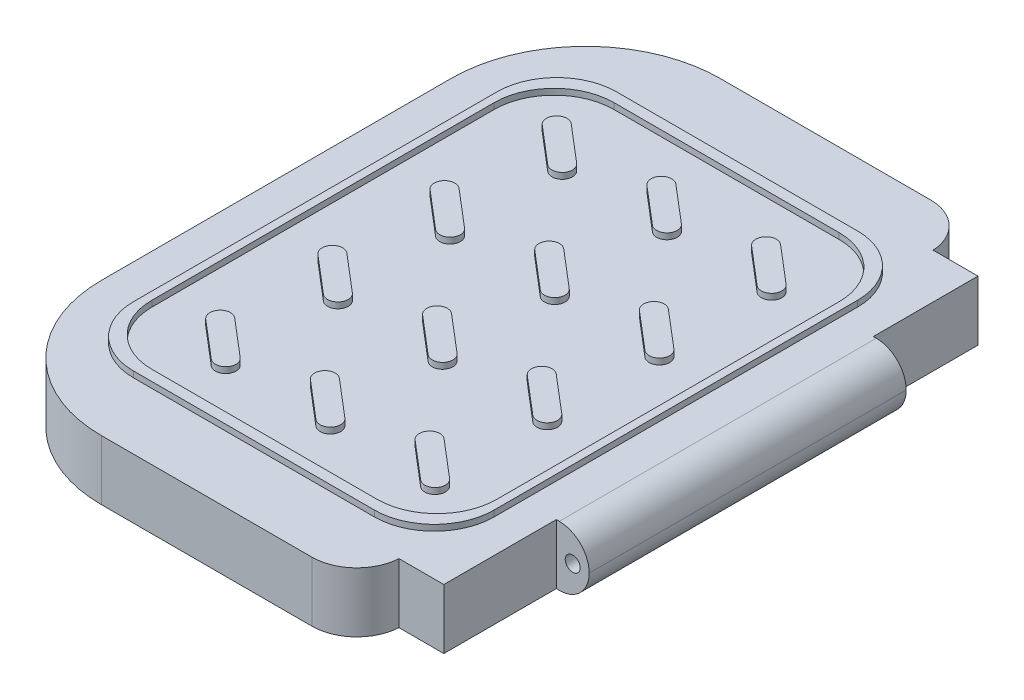
from build123d import *

# Parameters (mm, degrees)
BOSS_EXTRUDE1_DEPTH = 40
SKETCH2_R           = 5
CUT_EXTRUDE1_DEPTH  = 330
FILLET1_R           = 90
FILLET2_R           = 30
SHELL4_DEPTH        = 5.033370453
SHELL4_START        = -116.839892183
SHELL4_2_OUTLINE_W  = 270.611791966
SHELL4_2_OUTLINE_H  = 24.966629547
SHELL4_2_DEPTH      = 233.679784366
SHELL4_START_2      = -98.590943396
SHELL4_3_DEPTH      = 192
SHELL4_4_DEPTH      = 192
SHELL4_START_3      = 5.033370453
SHELL4_5_DEPTH      = 24.966629547
BOSS_EXTRUDE2_DEPTH = 4
BOSS_EXTRUDE3_DEPTH = 4
FILLET4_R           = 20


with BuildPart() as part:
    # Sketch1 → Boss-Extrude1 (new body)
    with BuildSketch(Plane(origin=(0, 0, 0), x_dir=(1, 0, 0), z_dir=(0, 1, 0))):
        Polygon((0, -103.409056604), (0, 108.590943396), (-22, 108.590943396), (-22, 178.590943396), (-51.997250674, 178.590943396), (-51.997250674, 206.839892183), (-312.611791966, 206.839892183), (-312.611791966, -206.839892183), (-51.997250674, -206.839892183), (-51.997250674, -178.590943396), (-22, -178.590943396), (-22, -173.409056604), (-22, -108.590943396), (-22, -103.409056604), align=None)
    extrude(amount=BOSS_EXTRUDE1_DEPTH)

    # Sketch2 → Cut-Extrude1 (cut, symmetric)
    with BuildSketch(Plane.XY.offset(103.409056604)):
        with Locations((-11, 20)):
            Circle(SKETCH2_R)
    extrude(amount=CUT_EXTRUDE1_DEPTH, both=True, mode=Mode.SUBTRACT)

    # Fillet1
    fillet1_edges = [part.edges().sort_by_distance(p)[0] for p in [
        (-312.611791966, 20, 206.839892183),
        (-312.611791966, 20, -206.839892183),
    ]]
    fillet(fillet1_edges, radius=FILLET1_R)

    # Fillet2
    # the kernel refuses this fillet: 30 mm, written as the material it takes off along each edge
    with BuildSketch(Plane(origin=(-51.997250674, -74.872133486, -206.839892183), x_dir=(-1, 0, 0), z_dir=(0, 1, 0))) as fillet2_piece_1:
        with BuildLine():
            CenterArc((29.948853395, 30), FILLET2_R, 183.3461633, 86.6538367)
            Line((0, 28.248948787), (-0.598977068, 28.213927763))
            ThreePointArc((-0.598977068, 28.213927763), (-0.6, 14.124474394), (-0.6, 0))
            Line((-0.6, 0), (0, -0.6))
            Line((0, -0.6), (29.948853395, -0.6))
            Line((29.948853395, -0.6), (29.948853395, 0))
        make_face()
    extrude(amount=189.744266973, mode=Mode.SUBTRACT)
    with BuildSketch(Plane(origin=(-51.997250674, -74.872133486, 206.839892183), x_dir=(-1, 0, 0), z_dir=(0, 1, 0))) as fillet2_piece_2:
        with BuildLine():
            CenterArc((29.948853395, -30), FILLET2_R, 90, 86.6538367)
            Line((0, -28.248948787), (-0.598977068, -28.213927763))
            ThreePointArc((-0.598977068, -28.213927763), (-0.6, -14.124474394), (-0.6, 0))
            Line((-0.6, 0), (0, 0.6))
            Line((0, 0.6), (29.948853395, 0.6))
            Line((29.948853395, 0.6), (29.948853395, 0))
        make_face()
    extrude(amount=189.744266973, mode=Mode.SUBTRACT)

    # Shell4: read off the stored shape, not the designer's step
    # Shell4 outline → Shell4 (cut)
    with BuildSketch(Plane(origin=(0, 0, 0), x_dir=(1, 0, 0), z_dir=(0, 1, 0))):
        with BuildLine():
            ThreePointArc((-302.611791966, -116.839892183), (-279.180334461, -173.408434678), (-222.611791966, -196.839892183))
            Line((-222.611791966, -196.839892183), (-81.946104068, -196.839892183))
            ThreePointArc((-81.946104068, -196.839892183), (-65.138680474, -187.680118755), (-63.726476084, -168.590943396))
            Line((-63.726476084, -168.590943396), (-32, -168.590943396))
            Line((-32, -168.590943396), (-32, -93.409056604))
            Line((-32, -93.409056604), (-10, -93.409056604))
            Line((-10, -93.409056604), (-10, 98.590943396))
            Line((-10, 98.590943396), (-32, 98.590943396))
            Line((-32, 98.590943396), (-32, 168.590943396))
            Line((-32, 168.590943396), (-63.726476084, 168.590943396))
            ThreePointArc((-63.726476084, 168.590943396), (-65.138680474, 187.680118755), (-81.946104068, 196.839892183))
            Line((-81.946104068, 196.839892183), (-222.611791966, 196.839892183))
            ThreePointArc((-222.611791966, 196.839892183), (-279.180334461, 173.408434678), (-302.611791966, 116.839892183))
            Line((-302.611791966, 116.839892183), (-302.611791966, -116.839892183))
        make_face()
    extrude(amount=SHELL4_DEPTH, mode=Mode.SUBTRACT)

    # Shell4 2 outline → Shell4 2 (cut)
    with BuildSketch(Plane.XY.offset(SHELL4_START)):
        with Locations((-167.305895983, 17.516685227)):
            Rectangle(SHELL4_2_OUTLINE_W, SHELL4_2_OUTLINE_H)
    extrude(amount=SHELL4_2_DEPTH, mode=Mode.SUBTRACT)

    # Shell4 3 outline → Shell4 3 (cut)
    with BuildSketch(Plane.XY.offset(SHELL4_START_2)):
        with BuildLine():
            Line((-32, 30), (-32, 5.033370453))
            Line((-32, 5.033370453), (-12.000000001, 5.033370453))
            ThreePointArc((-12.000000001, 5.033370453), (-24.889683858, 14.336371983), (-22.180339887, 30))
            Line((-22.180339887, 30), (-32, 30))
        make_face()
    extrude(amount=SHELL4_3_DEPTH, mode=Mode.SUBTRACT)

    # Shell4 4 outline → Shell4 4 (add)
    with BuildSketch(Plane.XY.offset(SHELL4_START_2)):
        with BuildLine():
            Line((-10, 5.033370453), (-12.000000001, 5.033370453))
            ThreePointArc((-12.000000001, 5.033370453), (-11, 5), (-10, 5.033370453))
        make_face()
    extrude(amount=SHELL4_4_DEPTH)

    # Shell4 5 outline → Shell4 5 (cut)
    with BuildSketch(Plane(origin=(0, 0, 0), x_dir=(1, 0, 0), z_dir=(0, 1, 0)).offset(SHELL4_START_3)):
        with BuildLine():
            ThreePointArc((-302.611791966, -116.839892183), (-279.180334461, -173.408434678), (-222.611791966, -196.839892183))
            Line((-222.611791966, -196.839892183), (-81.946104068, -196.839892183))
            ThreePointArc((-81.946104068, -196.839892183), (-65.138680474, -187.680118755), (-63.726476084, -168.590943396))
            Line((-63.726476084, -168.590943396), (-32, -168.590943396))
            Line((-32, -168.590943396), (-32, -116.839892183))
            Line((-32, -116.839892183), (-302.611791966, -116.839892183))
        make_face()
        with BuildLine():
            Line((-32, 116.839892183), (-32, 168.590943396))
            Line((-32, 168.590943396), (-63.726476084, 168.590943396))
            ThreePointArc((-63.726476084, 168.590943396), (-65.138680474, 187.680118755), (-81.946104068, 196.839892183))
            Line((-81.946104068, 196.839892183), (-222.611791966, 196.839892183))
            ThreePointArc((-222.611791966, 196.839892183), (-279.180334461, 173.408434678), (-302.611791966, 116.839892183))
            Line((-302.611791966, 116.839892183), (-32, 116.839892183))
        make_face()
    extrude(amount=SHELL4_5_DEPTH, mode=Mode.SUBTRACT)

    # Sketch4 → Boss-Extrude2 (add)
    with BuildSketch(Plane(origin=(0, 40, 0), x_dir=(1, 0, 0), z_dir=(0, 1, 0))):
        with BuildLine():
            Line((-84.305010565, 160.451269182), (-245.522953067, 160.451269182))
            ThreePointArc((-245.522953067, 160.451269182), (-273.807224315, 148.73554043), (-285.522953067, 120.451269182))
            Line((-285.522953067, 120.451269182), (-285.522953067, -122.672710688))
            ThreePointArc((-285.522953067, -122.672710688), (-273.807224315, -150.956981935), (-245.522953067, -162.672710688))
            Line((-245.522953067, -162.672710688), (-84.305010565, -162.672710688))
            ThreePointArc((-84.305010565, -162.672710688), (-56.020739318, -150.956981935), (-44.305010565, -122.672710688))
            Line((-44.305010565, -122.672710688), (-44.305010565, 120.451269182))
            ThreePointArc((-44.305010565, 120.451269182), (-56.020739318, 148.73554043), (-84.305010565, 160.451269182))
        make_face()
        with BuildLine():
            Line((-89.609738748, 153.34530988), (-240.218224885, 153.34530988))
            ThreePointArc((-240.218224885, 153.34530988), (-268.502496132, 141.629581127), (-280.218224885, 113.34530988))
            Line((-280.218224885, 113.34530988), (-280.218224885, -115.566751385))
            ThreePointArc((-280.218224885, -115.566751385), (-268.502496132, -143.851022632), (-240.218224885, -155.566751385))
            Line((-240.218224885, -155.566751385), (-89.609738748, -155.566751385))
            ThreePointArc((-89.609738748, -155.566751385), (-61.3254675, -143.851022632), (-49.609738748, -115.566751385))
            Line((-49.609738748, -115.566751385), (-49.609738748, 113.34530988))
            ThreePointArc((-49.609738748, 113.34530988), (-61.3254675, 141.629581127), (-89.609738748, 153.34530988))
        make_face(mode=Mode.SUBTRACT)
    extrude(amount=BOSS_EXTRUDE2_DEPTH)

    # Sketch5 → Boss-Extrude3 (add)
    with BuildSketch(Plane(origin=(0, 40, 0), x_dir=(1, 0, 0), z_dir=(0, 1, 0))):
        with BuildLine():
            Line((-226.333917402, 95.240932065), (-251.237947051, 116.446498802))
            ThreePointArc((-251.237947051, 116.446498802), (-252.014403521, 126.126762005), (-242.334140318, 126.903218475))
            Line((-242.334140318, 126.903218475), (-217.430110669, 105.697651738))
            ThreePointArc((-217.430110669, 105.697651738), (-216.653654199, 96.017388534), (-226.333917402, 95.240932065))
        make_face()
        with BuildLine():
            Line((-156.333917402, 95.240932065), (-181.237947051, 116.446498802))
            ThreePointArc((-181.237947051, 116.446498802), (-182.014403521, 126.126762005), (-172.334140318, 126.903218475))
            Line((-172.334140318, 126.903218475), (-147.430110669, 105.697651738))
            ThreePointArc((-147.430110669, 105.697651738), (-146.653654199, 96.017388534), (-156.333917402, 95.240932065))
        make_face()
        with BuildLine():
            Line((-86.333917402, 95.240932065), (-111.237947051, 116.446498802))
            ThreePointArc((-111.237947051, 116.446498802), (-112.014403521, 126.126762005), (-102.334140318, 126.903218475))
            Line((-102.334140318, 126.903218475), (-77.430110669, 105.697651738))
            ThreePointArc((-77.430110669, 105.697651738), (-76.653654199, 96.017388534), (-86.333917402, 95.240932065))
        make_face()
        with BuildLine():
            Line((-156.333917402, 20.240932065), (-181.237947051, 41.446498802))
            ThreePointArc((-181.237947051, 41.446498802), (-182.014403521, 51.126762005), (-172.334140318, 51.903218475))
            Line((-172.334140318, 51.903218475), (-147.430110669, 30.697651738))
            ThreePointArc((-147.430110669, 30.697651738), (-146.653654199, 21.017388534), (-156.333917402, 20.240932065))
        make_face()
        with BuildLine():
            Line((-86.333917402, 20.240932065), (-111.237947051, 41.446498802))
            ThreePointArc((-111.237947051, 41.446498802), (-112.014403521, 51.126762005), (-102.334140318, 51.903218475))
            Line((-102.334140318, 51.903218475), (-77.430110669, 30.697651738))
            ThreePointArc((-77.430110669, 30.697651738), (-76.653654199, 21.017388534), (-86.333917402, 20.240932065))
        make_face()
        with BuildLine():
            Line((-156.333917402, -54.759067935), (-181.237947051, -33.553501198))
            ThreePointArc((-181.237947051, -33.553501198), (-182.014403521, -23.873237995), (-172.334140318, -23.096781525))
            Line((-172.334140318, -23.096781525), (-147.430110669, -44.302348262))
            ThreePointArc((-147.430110669, -44.302348262), (-146.653654199, -53.982611466), (-156.333917402, -54.759067935))
        make_face()
        with BuildLine():
            Line((-86.333917402, -54.759067935), (-111.237947051, -33.553501198))
            ThreePointArc((-111.237947051, -33.553501198), (-112.014403521, -23.873237995), (-102.334140318, -23.096781525))
            Line((-102.334140318, -23.096781525), (-77.430110669, -44.302348262))
            ThreePointArc((-77.430110669, -44.302348262), (-76.653654199, -53.982611466), (-86.333917402, -54.759067935))
        make_face()
        with BuildLine():
            Line((-156.333917402, -129.759067935), (-181.237947051, -108.553501198))
            ThreePointArc((-181.237947051, -108.553501198), (-182.014403521, -98.873237995), (-172.334140318, -98.096781525))
            Line((-172.334140318, -98.096781525), (-147.430110669, -119.302348262))
            ThreePointArc((-147.430110669, -119.302348262), (-146.653654199, -128.982611466), (-156.333917402, -129.759067935))
        make_face()
        with BuildLine():
            Line((-86.333917402, -129.759067935), (-111.237947051, -108.553501198))
            ThreePointArc((-111.237947051, -108.553501198), (-112.014403521, -98.873237995), (-102.334140318, -98.096781525))
            Line((-102.334140318, -98.096781525), (-77.430110669, -119.302348262))
            ThreePointArc((-77.430110669, -119.302348262), (-76.653654199, -128.982611466), (-86.333917402, -129.759067935))
        make_face()
        with BuildLine():
            Line((-226.333917402, 20.240932065), (-251.237947051, 41.446498802))
            ThreePointArc((-251.237947051, 41.446498802), (-252.014403521, 51.126762005), (-242.334140318, 51.903218475))
            Line((-242.334140318, 51.903218475), (-217.430110669, 30.697651738))
            ThreePointArc((-217.430110669, 30.697651738), (-216.653654199, 21.017388534), (-226.333917402, 20.240932065))
        make_face()
        with BuildLine():
            Line((-226.333917402, -54.759067935), (-251.237947051, -33.553501198))
            ThreePointArc((-251.237947051, -33.553501198), (-252.014403521, -23.873237995), (-242.334140318, -23.096781525))
            Line((-242.334140318, -23.096781525), (-217.430110669, -44.302348262))
            ThreePointArc((-217.430110669, -44.302348262), (-216.653654199, -53.982611466), (-226.333917402, -54.759067935))
        make_face()
        with BuildLine():
            Line((-226.333917402, -129.759067935), (-251.237947051, -108.553501198))
            ThreePointArc((-251.237947051, -108.553501198), (-252.014403521, -98.873237995), (-242.334140318, -98.096781525))
            Line((-242.334140318, -98.096781525), (-217.430110669, -119.302348262))
            ThreePointArc((-217.430110669, -119.302348262), (-216.653654199, -128.982611466), (-226.333917402, -129.759067935))
        make_face()
    extrude(amount=BOSS_EXTRUDE3_DEPTH)

    # Fillet4
    # the kernel refuses this fillet: 20 mm, written as the material it takes off along each edge
    with BuildSketch(Plane(origin=(0, 0, 153.409056604), x_dir=(-1, 0, 0), z_dir=(0, 0, -1)), Plane(origin=(0, 40, 153.409056604), x_dir=(0, -1, 0), z_dir=(0, 0, -1))) as fillet4_piece_1:
        with BuildLine():
            CenterArc((FILLET4_R, FILLET4_R), FILLET4_R, 180, 90)
            Line((0, FILLET4_R), (0, 0))
            Line((0, 0), (FILLET4_R, 0))
        make_face()
    extrude(amount=312, mode=Mode.SUBTRACT)


solid = part.part
